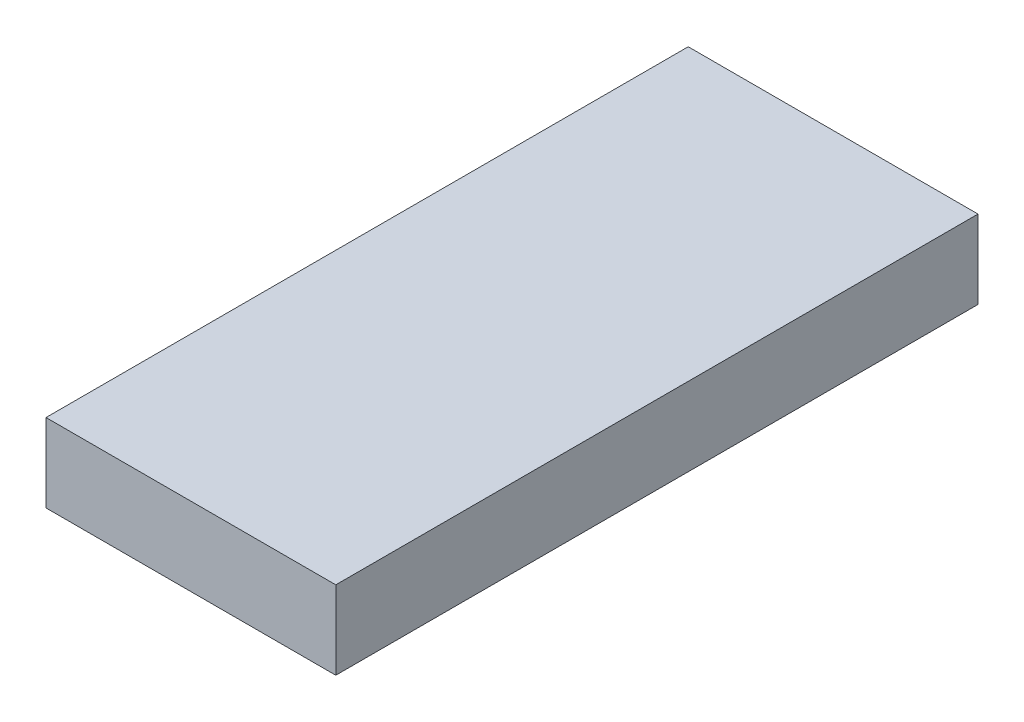
from build123d import *

# Parameters (mm, degrees)
SKETCH1_W           = 18.5
SKETCH1_H           = 41
BOSS_EXTRUDE1_DEPTH = 2.5


with BuildPart() as part:
    # Sketch1 → Boss-Extrude1 (new, symmetric)
    with BuildSketch(Plane(origin=(0, 0, 0), x_dir=(1, 0, 0), z_dir=(0, 1, 0))):
        Rectangle(SKETCH1_W, SKETCH1_H)
    extrude(amount=BOSS_EXTRUDE1_DEPTH, both=True)


solid = part.part
